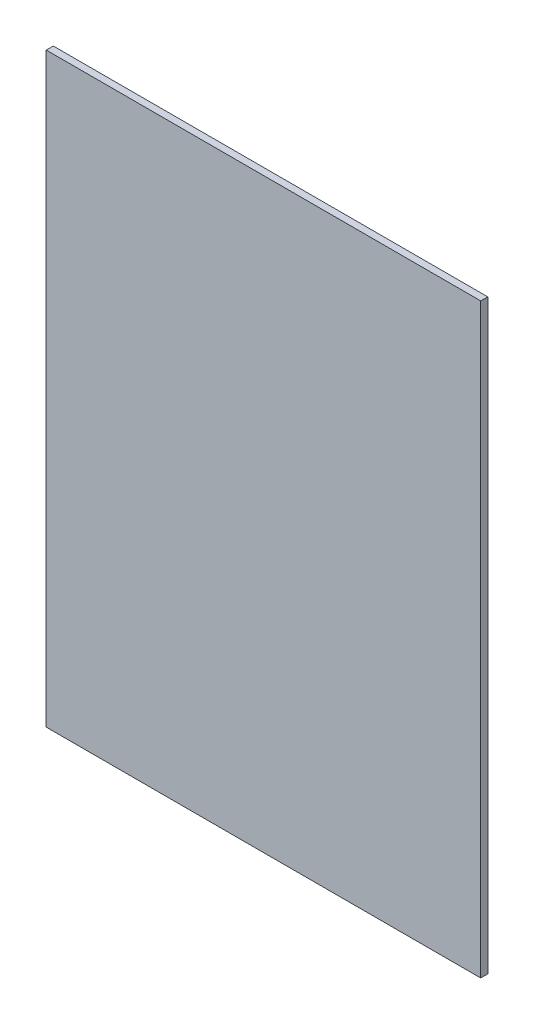
from build123d import *

# Parameters (mm, degrees)
SKETCH1_W           = 98.840202878
SKETCH1_H           = 133.401022209
BOSS_EXTRUDE1_DEPTH = 1.6


with BuildPart() as part:
    # Sketch1 → Boss-Extrude1 (new body)
    with BuildSketch(Plane.XY.offset(10)):
        with Locations((49.420101439, 41.7856983)):
            Rectangle(SKETCH1_W, SKETCH1_H)
    extrude(amount=BOSS_EXTRUDE1_DEPTH)


solid = part.part
